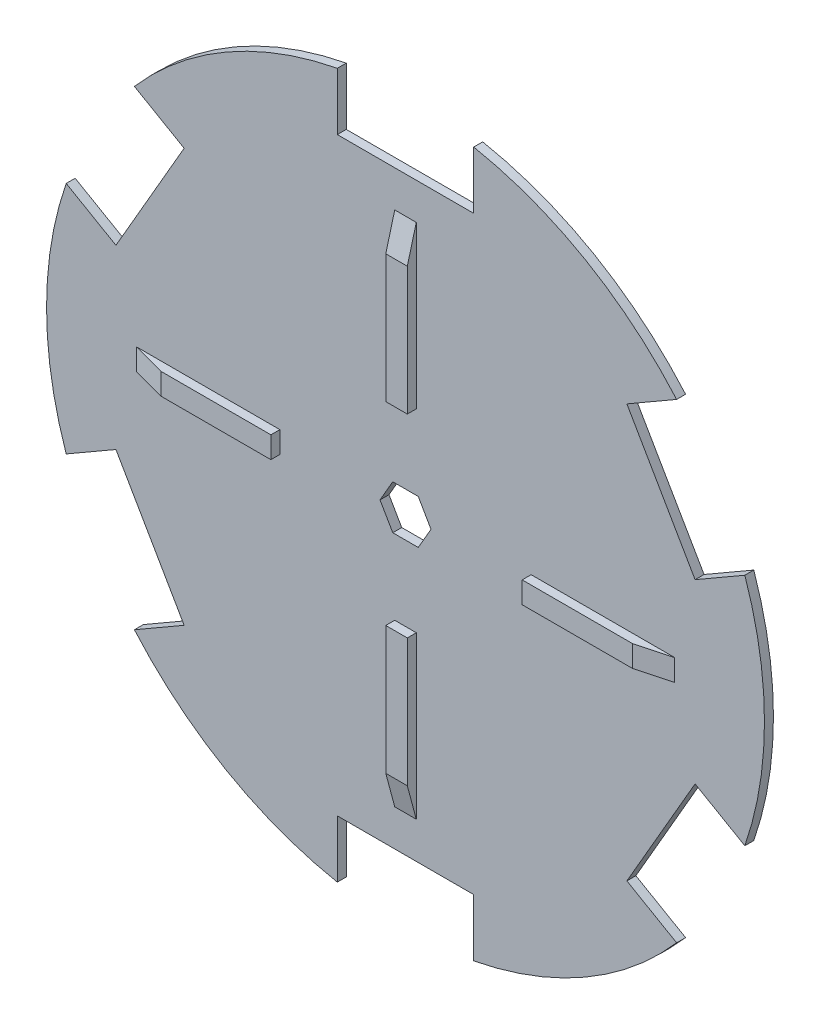
from build123d import *
from OCP.BRepFilletAPI import BRepFilletAPI_MakeChamfer

# Parameters (mm, degrees)
SKETCH1_R           = 100
BOSS_EXTRUDE1_DEPTH = 2.5
SKETCH8_W           = 1.221153846
SKETCH8_H           = 0.325641026
CUT_EXTRUDE6_DEPTH  = 0.2
CUT_EXTRUDE7_DEPTH  = 10
BOSS_EXTRUDE2_DEPTH = 2.5
CHAMFER1_SIZE       = 2.5
CHAMFER1_SIZE_2     = 9.330127019
CUT_EXTRUDE8_START  = -10
CUT_EXTRUDE8_DEPTH  = 10


with BuildPart() as part:
    # Sketch1 → Boss-Extrude1 (new body)
    with BuildSketch(Plane.XY):
        Circle(SKETCH1_R)
    extrude(amount=BOSS_EXTRUDE1_DEPTH)

    # Sketch8 → Cut-Extrude6 (cut)
    # profile 1 of 12: a face of its own
    with BuildSketch(Plane(origin=(0, 0, 0), x_dir=(-1, 0, 0), z_dir=(0, 0, -1))):
        with BuildLine():
            add(Edge.make_bspline(
                [(-21.303796635, -42.5044388), (-21.303499075, -42.453550456), (-21.302921062, -42.354699113), (-21.296490852, -42.210658759), (-21.285808934, -42.075530497), (-21.271170032, -41.949307858), (-21.253355578, -41.831958258), (-21.229574387, -41.723795299), (-21.202529916, -41.62431837), (-21.171185911, -41.533203084), (-21.135818417, -41.449221882), (-21.09732448, -41.370821878), (-21.054176417, -41.298121696), (-21.008840217, -41.229960986), (-20.959480695, -41.167455492), (-20.907502507, -41.109722505), (-20.850876948, -41.058096324), (-20.791528933, -41.011064321), (-20.72892114, -40.969835158), (-20.66483815, -40.933519745), (-20.598838876, -40.902495579), (-20.530743124, -40.878102113), (-20.461162947, -40.857953702), (-20.389855107, -40.844175156), (-20.31670187, -40.835505675), (-20.267324783, -40.834676848), (-20.242283213, -40.834256508)],
                knots=[0, 0, 0, 0, 1.646270934, 3.197905019, 4.663502075, 6.030701355, 7.308322542, 8.50163776, 9.611534131, 10.641858119, 11.616356847, 12.558055219, 13.465016945, 14.349605745, 15.204443733, 16.039544428, 16.859896111, 17.680448484, 18.487036065, 19.28249412, 20.06191084, 20.843045899, 21.620316918, 22.403196591, 23.190181807, 24, 24, 24, 24], degree=3))
            add(Edge.make_bspline(
                [(-20.242283213, -40.834256508), (-20.217032458, -40.834699027), (-20.16681665, -40.835579056), (-20.092575738, -40.844037204), (-20.020049955, -40.858071722), (-19.949548501, -40.877957178), (-19.880492263, -40.902627542), (-19.813421379, -40.933549427), (-19.747919241, -40.969543828), (-19.685026766, -41.011838345), (-19.624053507, -41.058993695), (-19.566497141, -41.112299831), (-19.512352427, -41.171218505), (-19.460939829, -41.235119338), (-19.413717966, -41.305227951), (-19.368747781, -41.380324965), (-19.328496005, -41.461723678), (-19.28972955, -41.548065959), (-19.256267783, -41.64174085), (-19.226090547, -41.742220311), (-19.201707482, -41.850691181), (-19.181397214, -41.966584346), (-19.165662915, -42.09032542), (-19.154203304, -42.221649149), (-19.148149863, -42.360641932), (-19.147009855, -42.455672267), (-19.14642484, -42.5044388)],
                knots=[0, 0, 0, 0, 0.810914788, 1.612654377, 2.396697861, 3.181598691, 3.963628158, 4.749916497, 5.551656086, 6.361998678, 7.18212741, 8.025565596, 8.878627764, 9.750805457, 10.657531673, 11.591944965, 12.560506719, 13.57287815, 14.630710178, 15.753379473, 16.941251878, 18.199788006, 19.531962791, 20.947069417, 22.433333509, 24, 24, 24, 24], degree=3))
            add(Edge.make_bspline(
                [(-19.14642484, -42.5044388), (-19.14701592, -42.552992631), (-19.148167616, -42.64759779), (-19.154135443, -42.785965175), (-19.165890773, -42.916591971), (-19.180595548, -43.039791462), (-19.200961778, -43.155050874), (-19.226003608, -43.262769052), (-19.253807829, -43.363411174), (-19.288129392, -43.456152753), (-19.325694822, -43.54228753), (-19.366566322, -43.622721301), (-19.41035395, -43.698165009), (-19.458059454, -43.768014779), (-19.508907908, -43.832765418), (-19.563987616, -43.891273976), (-19.621745933, -43.944950228), (-19.682898624, -43.992712776), (-19.74677196, -44.034518277), (-19.812049122, -44.071905127), (-19.879888334, -44.102051929), (-19.948752227, -44.127937288), (-20.019625817, -44.147713412), (-20.092420757, -44.161387553), (-20.166766771, -44.170977729), (-20.217023905, -44.171709322), (-20.242283213, -44.172077021)],
                knots=[0, 0, 0, 0, 1.561518951, 3.042555995, 4.452378317, 5.7783523, 7.031515105, 8.214008947, 9.334062868, 10.386615937, 11.391082383, 12.354592575, 13.286541444, 14.194233754, 15.072674879, 15.931287219, 16.775624067, 17.606195743, 18.42308326, 19.229000347, 20.022332153, 20.807536673, 21.593273796, 22.3848459, 23.188221202, 24, 24, 24, 24], degree=3))
            add(Edge.make_bspline(
                [(-20.242283213, -44.172077021), (-20.267324088, -44.17165397), (-20.316699806, -44.170819796), (-20.389863077, -44.162189483), (-20.460876437, -44.148314276), (-20.530090306, -44.128886357), (-20.597859788, -44.105105755), (-20.663261419, -44.074123485), (-20.72702239, -44.038441865), (-20.788972587, -43.997806019), (-20.847947904, -43.951249921), (-20.904280211, -43.899756602), (-20.956554335, -43.842041078), (-21.005208122, -43.779014677), (-21.051448902, -43.711257236), (-21.093984262, -43.63784364), (-21.133327822, -43.559064986), (-21.169290132, -43.47441231), (-21.201174991, -43.38265034), (-21.229339697, -43.282729299), (-21.25157754, -43.173767258), (-21.270612078, -43.056639361), (-21.285964912, -42.930842295), (-21.296446335, -42.796307768), (-21.302924528, -42.653119614), (-21.303500628, -42.554903462), (-21.303796635, -42.5044388)],
                knots=[0, 0, 0, 0, 0.810891512, 1.598919785, 2.382837074, 3.152667961, 3.926044502, 4.706494248, 5.493654104, 6.291793342, 7.103789334, 7.925228297, 8.761435821, 9.622817696, 10.50288917, 11.416980706, 12.369136599, 13.353924996, 14.394355917, 15.514179734, 16.714354668, 17.994756427, 19.357759367, 20.818452758, 22.365282078, 24, 24, 24, 24], degree=3))
        make_face()
        with BuildLine():
            add(Edge.make_bspline(
                [(-21.018860737, -42.503166765), (-21.018752382, -42.545574513), (-21.018542085, -42.627879625), (-21.013048246, -42.747480298), (-21.005564107, -42.859031953), (-20.99591093, -42.962676233), (-20.981575398, -43.058062315), (-20.965512812, -43.145846242), (-20.945965617, -43.22556345), (-20.922837993, -43.297760964), (-20.896495384, -43.363664048), (-20.867733636, -43.424988007), (-20.836835695, -43.482457264), (-20.802256179, -43.535555608), (-20.764596086, -43.5844562), (-20.724706058, -43.630024555), (-20.681097357, -43.670661817), (-20.620768962, -43.71939975), (-20.541125017, -43.769763535), (-20.440776462, -43.813620345), (-20.337662938, -43.841181574), (-20.267675733, -43.844686552), (-20.232742949, -43.846435996)],
                knots=[0, 0, 0, 0, 1.459021318, 2.831673884, 4.118529203, 5.306027144, 6.411944654, 7.436330062, 8.375795394, 9.233974572, 10.042671642, 10.816086306, 11.563610507, 12.285937304, 12.993564865, 13.685989202, 14.367179055, 15.041617293, 16.353048772, 17.594441528, 18.799311195, 20, 20, 20, 20], degree=3))
            add(Edge.make_bspline(
                [(-20.232742949, -43.846435996), (-20.197584204, -43.84498658), (-20.127339304, -43.842090742), (-20.024710789, -43.814151887), (-19.925079044, -43.771997376), (-19.846999499, -43.722152139), (-19.787597477, -43.674682869), (-19.745037065, -43.63421101), (-19.705973635, -43.588893901), (-19.668924038, -43.53999954), (-19.634943305, -43.486593787), (-19.604043173, -43.42893345), (-19.575846137, -43.36685841), (-19.559781502, -43.323524433), (-19.551568069, -43.301368888)],
                knots=[0, 0, 0, 0, 1.353760809, 2.704726607, 4.075137775, 5.516104923, 6.260822281, 7.007110065, 7.778089737, 8.566572457, 9.372053459, 10.217411131, 11.088608312, 12, 12, 12, 12], degree=3))
            add(Edge.make_bspline(
                [(-19.551568069, -43.301368888), (-19.541996108, -43.273039053), (-19.522560923, -43.215517338), (-19.497513099, -43.126287454), (-19.477786916, -43.032667804), (-19.460040148, -42.935217877), (-19.447927019, -42.833219005), (-19.438177217, -42.726986785), (-19.432434379, -42.616441121), (-19.431722498, -42.541334236), (-19.431360737, -42.503166765)],
                knots=[0, 0, 0, 0, 0.884706709, 1.796334032, 2.740027952, 3.714592787, 4.726048262, 5.777819803, 6.87074269, 8, 8, 8, 8], degree=3))
            add(Edge.make_bspline(
                [(-19.431360737, -42.503166765), (-19.431859838, -42.465005467), (-19.432836184, -42.39035381), (-19.436568159, -42.281026604), (-19.446205259, -42.177187992), (-19.456908745, -42.078390635), (-19.47269051, -41.985181431), (-19.48970652, -41.896780083), (-19.51256762, -41.814281768), (-19.536987702, -41.736394861), (-19.564937132, -41.664004268), (-19.595703548, -41.596772476), (-19.628561858, -41.534374904), (-19.66425089, -41.47698275), (-19.702346974, -41.424338943), (-19.743855608, -41.377498989), (-19.787130289, -41.335011168), (-19.847743022, -41.286512981), (-19.927094699, -41.237063086), (-20.025833251, -41.191555575), (-20.128585906, -41.165422338), (-20.198048968, -41.161737808), (-20.232742949, -41.159897534)],
                knots=[0, 0, 0, 0, 1.31362396, 2.569729283, 3.763502607, 4.902122613, 5.988968491, 7.01645872, 7.998833611, 8.933434873, 9.825090667, 10.667526885, 11.477055099, 12.250526234, 12.991942729, 13.710640831, 14.402115721, 15.076753259, 16.378508321, 17.609869233, 18.806226677, 20, 20, 20, 20], degree=3))
            add(Edge.make_bspline(
                [(-20.232742949, -41.159897534), (-20.267858986, -41.161740346), (-20.338155033, -41.165429328), (-20.441975678, -41.191458208), (-20.541493197, -41.236827113), (-20.620635038, -41.286676765), (-20.681290045, -41.334155091), (-20.724000774, -41.375327088), (-20.764047658, -41.420363333), (-20.800939072, -41.469713642), (-20.835491493, -41.522750082), (-20.867224269, -41.57988989), (-20.895814989, -41.641422628), (-20.922198819, -41.707296108), (-20.945396991, -41.779487394), (-20.964532229, -41.859106409), (-20.98220977, -41.946611125), (-20.994724049, -42.042513822), (-21.005849028, -42.146184061), (-21.012998536, -42.2580142), (-21.018560463, -42.377815459), (-21.018758641, -42.460546124), (-21.018860737, -42.503166765)],
                knots=[0, 0, 0, 0, 1.207732386, 2.417664972, 3.655092373, 4.956220595, 5.625982001, 6.301752483, 6.994047911, 7.697131622, 8.419323945, 9.170223765, 9.943494443, 10.752040957, 11.610060368, 12.549350801, 13.567764191, 14.679664412, 15.874934091, 17.154273443, 18.533957287, 20, 20, 20, 20], degree=3))
        make_face(mode=Mode.SUBTRACT)
    # profile 2 of 12: a face of its own
    with BuildSketch(Plane(origin=(0, 0, 0), x_dir=(-1, 0, 0), z_dir=(0, 0, -1))):
        with BuildLine():
            Line((-18.45443766, -41.892589842), (-18.739373558, -41.892589842))
            add(Edge.make_bspline(
                [(-18.739373558, -41.892589842), (-18.737516498, -41.854788394), (-18.733869281, -41.780547355), (-18.716789333, -41.672303526), (-18.692350108, -41.56883953), (-18.657795718, -41.470986108), (-18.614882166, -41.377878047), (-18.563419927, -41.289885176), (-18.502465505, -41.207343169), (-18.433335111, -41.131017218), (-18.358252131, -41.060997065), (-18.277238886, -41.000531237), (-18.19210804, -40.949443064), (-18.103117871, -40.906733652), (-18.00926436, -40.874675363), (-17.911399196, -40.85088859), (-17.809092408, -40.836577191), (-17.73938753, -40.835038871), (-17.703936859, -40.834256508)],
                knots=[0, 0, 0, 0, 1.10065271, 2.161652631, 3.183658789, 4.190468796, 5.17591951, 6.163126047, 7.15150782, 8.156236427, 9.156009102, 10.134482811, 11.092018607, 12.041330605, 13.001268258, 13.972401359, 14.968799086, 16, 16, 16, 16], degree=3))
            add(Edge.make_bspline(
                [(-17.703936859, -40.834256508), (-17.669122463, -40.835071537), (-17.600713419, -40.836673038), (-17.500871449, -40.850426258), (-17.405823475, -40.871966902), (-17.315755287, -40.902188744), (-17.231385499, -40.942814617), (-17.152080309, -40.99161667), (-17.076895574, -41.048058946), (-17.009216563, -41.114510619), (-16.947069948, -41.185451354), (-16.893455759, -41.261186809), (-16.84754239, -41.33940909), (-16.809272137, -41.420714673), (-16.781099783, -41.505869105), (-16.75971098, -41.593632639), (-16.747621111, -41.684913718), (-16.74576562, -41.746696093), (-16.744822276, -41.778106669)],
                knots=[0, 0, 0, 0, 1.111607364, 2.184268762, 3.212621178, 4.221274766, 5.211760367, 6.196651075, 7.1921475, 8.207485113, 9.220403448, 10.201281604, 11.166441695, 12.114753415, 13.065576456, 14.026450734, 14.996634279, 16, 16, 16, 16], degree=3))
            add(Edge.make_bspline(
                [(-16.744822276, -41.778106669), (-16.746358307, -41.822327919), (-16.749403415, -41.909994398), (-16.775451456, -42.038822167), (-16.816133648, -42.163639054), (-16.865116965, -42.264093606), (-16.914531253, -42.345041133), (-16.959060635, -42.411687744), (-17.011189428, -42.483447704), (-17.071676351, -42.560080718), (-17.139270171, -42.642187039), (-17.214583134, -42.729717067), (-17.298152292, -42.821766459), (-17.356806789, -42.88463654), (-17.38720008, -42.917214241)],
                knots=[0, 0, 0, 0, 1.184426356, 2.348067706, 3.509069118, 4.696110526, 5.333549288, 6.050745305, 6.844228056, 7.710549037, 8.667450064, 9.695053472, 10.805634456, 12, 12, 12, 12], degree=3))
            Line((-17.38720008, -42.917214241), (-18.181586098, -43.765025739))
            Line((-18.181586098, -43.765025739), (-16.704117148, -43.765025739))
            Line((-16.704117148, -43.765025739), (-16.704117148, -44.090666765))
            Line((-16.704117148, -44.090666765), (-18.861488943, -44.090666765))
            Line((-18.861488943, -44.090666765), (-17.630158814, -42.776654345))
            add(Edge.make_bspline(
                [(-17.630158814, -42.776654345), (-17.60017966, -42.745359453), (-17.54259584, -42.685248369), (-17.461150216, -42.597488684), (-17.387999134, -42.516073029), (-17.322669071, -42.441155231), (-17.266577248, -42.371639452), (-17.216800295, -42.309777114), (-17.176917223, -42.252849863), (-17.133632542, -42.186863734), (-17.091709859, -42.106298275), (-17.055685079, -42.007842714), (-17.033718752, -41.906490135), (-17.031083652, -41.837999001), (-17.029758173, -41.803547374)],
                knots=[0, 0, 0, 0, 1.329631726, 2.553950428, 3.673215718, 4.687767853, 5.603093632, 6.413772471, 7.123043292, 7.734684054, 8.834405432, 9.900288307, 10.943827018, 12, 12, 12, 12], degree=3))
            add(Edge.make_bspline(
                [(-17.029758173, -41.803547374), (-17.030334882, -41.781883534), (-17.031471465, -41.739188265), (-17.041502377, -41.676590184), (-17.056661193, -41.616206389), (-17.078382963, -41.557851141), (-17.107054791, -41.502111157), (-17.141955643, -41.448918586), (-17.182223772, -41.397493596), (-17.228806709, -41.349275961), (-17.279980016, -41.305115153), (-17.334040514, -41.265995447), (-17.391235966, -41.233302825), (-17.451325219, -41.206502653), (-17.514140752, -41.185479271), (-17.579804057, -41.170911846), (-17.6481337, -41.161765592), (-17.694791229, -41.160528093), (-17.718565265, -41.159897534)],
                knots=[0, 0, 0, 0, 0.991446411, 1.95395049, 2.89581595, 3.838931463, 4.798493298, 5.75982156, 6.748411868, 7.785213223, 8.824556874, 9.840280684, 10.836137867, 11.835679398, 12.848801643, 13.863922112, 14.911575587, 16, 16, 16, 16], degree=3))
            add(Edge.make_bspline(
                [(-17.718565265, -41.159897534), (-17.74339452, -41.160546171), (-17.792155078, -41.161819985), (-17.863745915, -41.170730545), (-17.93204087, -41.186102843), (-17.997211739, -41.207127398), (-18.059368792, -41.23385051), (-18.118209747, -41.267135164), (-18.17360251, -41.306853047), (-18.225651214, -41.351884123), (-18.273606395, -41.402019733), (-18.315740346, -41.457908771), (-18.352555845, -41.518530783), (-18.384677078, -41.583722197), (-18.410762597, -41.654074554), (-18.430695384, -41.729338115), (-18.446467737, -41.809186083), (-18.451736895, -41.864326838), (-18.45443766, -41.892589842)],
                knots=[0, 0, 0, 0, 1.031018746, 2.02475058, 2.990194455, 3.934040569, 4.864654155, 5.795059489, 6.735614925, 7.690564532, 8.649604399, 9.611025574, 10.590972636, 11.591080095, 12.624614302, 13.701020113, 14.821632451, 16, 16, 16, 16], degree=3))
        make_face()
    # profile 3 of 12: a face of its own
    with BuildSketch(Plane(origin=(0, 0, 0), x_dir=(-1, 0, 0), z_dir=(0, 0, -1))):
        with Locations((-15.808604327, -42.869512919)):
            Rectangle(SKETCH8_W, SKETCH8_H)
    # profile 4 of 12: a face of its own
    with BuildSketch(Plane(origin=(0, 0, 0), x_dir=(-1, 0, 0), z_dir=(0, 0, -1))):
        with BuildLine():
            add(Edge.make_bspline(
                [(-14.953796635, -42.5044388), (-14.953499075, -42.453550456), (-14.952921062, -42.354699113), (-14.946490852, -42.210658759), (-14.935808934, -42.075530497), (-14.921170032, -41.949307858), (-14.903355578, -41.831958258), (-14.879574387, -41.723795299), (-14.852529916, -41.62431837), (-14.821185911, -41.533203084), (-14.785818417, -41.449221882), (-14.74732448, -41.370821878), (-14.704176417, -41.298121696), (-14.658840217, -41.229960986), (-14.609480695, -41.167455492), (-14.557502507, -41.109722505), (-14.500876948, -41.058096324), (-14.441528933, -41.011064321), (-14.37892114, -40.969835158), (-14.31483815, -40.933519745), (-14.248838876, -40.902495579), (-14.180743124, -40.878102113), (-14.111162947, -40.857953702), (-14.039855107, -40.844175156), (-13.96670187, -40.835505675), (-13.917324783, -40.834676848), (-13.892283213, -40.834256508)],
                knots=[0, 0, 0, 0, 1.646270934, 3.197905019, 4.663502075, 6.030701355, 7.308322542, 8.50163776, 9.611534131, 10.641858119, 11.616356847, 12.558055219, 13.465016945, 14.349605745, 15.204443733, 16.039544428, 16.859896111, 17.680448484, 18.487036065, 19.28249412, 20.06191084, 20.843045899, 21.620316918, 22.403196591, 23.190181807, 24, 24, 24, 24], degree=3))
            add(Edge.make_bspline(
                [(-13.892283213, -40.834256508), (-13.867032458, -40.834699027), (-13.81681665, -40.835579056), (-13.742575738, -40.844037204), (-13.670049955, -40.858071722), (-13.599548501, -40.877957178), (-13.530492263, -40.902627542), (-13.463421379, -40.933549427), (-13.397919241, -40.969543828), (-13.335026766, -41.011838345), (-13.274053507, -41.058993695), (-13.216497141, -41.112299831), (-13.162352427, -41.171218505), (-13.110939829, -41.235119338), (-13.063717966, -41.305227951), (-13.018747781, -41.380324965), (-12.978496005, -41.461723678), (-12.93972955, -41.548065959), (-12.906267783, -41.64174085), (-12.876090547, -41.742220311), (-12.851707482, -41.850691181), (-12.831397214, -41.966584346), (-12.815662915, -42.09032542), (-12.804203304, -42.221649149), (-12.798149863, -42.360641932), (-12.797009855, -42.455672267), (-12.79642484, -42.5044388)],
                knots=[0, 0, 0, 0, 0.810914788, 1.612654377, 2.396697861, 3.181598691, 3.963628158, 4.749916497, 5.551656086, 6.361998678, 7.18212741, 8.025565596, 8.878627764, 9.750805457, 10.657531673, 11.591944965, 12.560506719, 13.57287815, 14.630710178, 15.753379473, 16.941251878, 18.199788006, 19.531962791, 20.947069417, 22.433333509, 24, 24, 24, 24], degree=3))
            add(Edge.make_bspline(
                [(-12.79642484, -42.5044388), (-12.79701592, -42.552992631), (-12.798167616, -42.64759779), (-12.804135443, -42.785965175), (-12.815890773, -42.916591971), (-12.830595548, -43.039791462), (-12.850961778, -43.155050874), (-12.876003608, -43.262769052), (-12.903807829, -43.363411174), (-12.938129392, -43.456152753), (-12.975694822, -43.54228753), (-13.016566322, -43.622721301), (-13.06035395, -43.698165009), (-13.108059454, -43.768014779), (-13.158907908, -43.832765418), (-13.213987616, -43.891273976), (-13.271745933, -43.944950228), (-13.332898624, -43.992712776), (-13.39677196, -44.034518277), (-13.462049122, -44.071905127), (-13.529888334, -44.102051929), (-13.598752227, -44.127937288), (-13.669625817, -44.147713412), (-13.742420757, -44.161387553), (-13.816766771, -44.170977729), (-13.867023905, -44.171709322), (-13.892283213, -44.172077021)],
                knots=[0, 0, 0, 0, 1.561518951, 3.042555995, 4.452378317, 5.7783523, 7.031515105, 8.214008947, 9.334062868, 10.386615937, 11.391082383, 12.354592575, 13.286541444, 14.194233754, 15.072674879, 15.931287219, 16.775624067, 17.606195743, 18.42308326, 19.229000347, 20.022332153, 20.807536673, 21.593273796, 22.3848459, 23.188221202, 24, 24, 24, 24], degree=3))
            add(Edge.make_bspline(
                [(-13.892283213, -44.172077021), (-13.917324088, -44.17165397), (-13.966699806, -44.170819796), (-14.039863077, -44.162189483), (-14.110876437, -44.148314276), (-14.180090306, -44.128886357), (-14.247859788, -44.105105755), (-14.313261419, -44.074123485), (-14.37702239, -44.038441865), (-14.438972587, -43.997806019), (-14.497947904, -43.951249921), (-14.554280211, -43.899756602), (-14.606554335, -43.842041078), (-14.655208122, -43.779014677), (-14.701448902, -43.711257236), (-14.743984262, -43.63784364), (-14.783327822, -43.559064986), (-14.819290132, -43.47441231), (-14.851174991, -43.38265034), (-14.879339697, -43.282729299), (-14.90157754, -43.173767258), (-14.920612078, -43.056639361), (-14.935964912, -42.930842295), (-14.946446335, -42.796307768), (-14.952924528, -42.653119614), (-14.953500628, -42.554903462), (-14.953796635, -42.5044388)],
                knots=[0, 0, 0, 0, 0.810891512, 1.598919785, 2.382837074, 3.152667961, 3.926044502, 4.706494248, 5.493654104, 6.291793342, 7.103789334, 7.925228297, 8.761435821, 9.622817696, 10.50288917, 11.416980706, 12.369136599, 13.353924996, 14.394355917, 15.514179734, 16.714354668, 17.994756427, 19.357759367, 20.818452758, 22.365282078, 24, 24, 24, 24], degree=3))
        make_face()
        with BuildLine():
            add(Edge.make_bspline(
                [(-14.668860737, -42.503166765), (-14.668752382, -42.545574513), (-14.668542085, -42.627879625), (-14.663048246, -42.747480298), (-14.655564107, -42.859031953), (-14.64591093, -42.962676233), (-14.631575398, -43.058062315), (-14.615512812, -43.145846242), (-14.595965617, -43.22556345), (-14.572837993, -43.297760964), (-14.546495384, -43.363664048), (-14.517733636, -43.424988007), (-14.486835695, -43.482457264), (-14.452256179, -43.535555608), (-14.414596086, -43.5844562), (-14.374706058, -43.630024555), (-14.331097357, -43.670661817), (-14.270768962, -43.71939975), (-14.191125017, -43.769763535), (-14.090776462, -43.813620345), (-13.987662938, -43.841181574), (-13.917675733, -43.844686552), (-13.882742949, -43.846435996)],
                knots=[0, 0, 0, 0, 1.459021318, 2.831673884, 4.118529203, 5.306027144, 6.411944654, 7.436330062, 8.375795394, 9.233974572, 10.042671642, 10.816086306, 11.563610507, 12.285937304, 12.993564865, 13.685989202, 14.367179055, 15.041617293, 16.353048772, 17.594441528, 18.799311195, 20, 20, 20, 20], degree=3))
            add(Edge.make_bspline(
                [(-13.882742949, -43.846435996), (-13.847584204, -43.84498658), (-13.777339304, -43.842090742), (-13.674710789, -43.814151887), (-13.575079044, -43.771997376), (-13.496999499, -43.722152139), (-13.437597477, -43.674682869), (-13.395037065, -43.63421101), (-13.355973635, -43.588893901), (-13.318924038, -43.53999954), (-13.284943305, -43.486593787), (-13.254043173, -43.42893345), (-13.225846137, -43.36685841), (-13.209781502, -43.323524433), (-13.201568069, -43.301368888)],
                knots=[0, 0, 0, 0, 1.353760809, 2.704726607, 4.075137775, 5.516104923, 6.260822281, 7.007110065, 7.778089737, 8.566572457, 9.372053459, 10.217411131, 11.088608312, 12, 12, 12, 12], degree=3))
            add(Edge.make_bspline(
                [(-13.201568069, -43.301368888), (-13.191996108, -43.273039053), (-13.172560923, -43.215517338), (-13.147513099, -43.126287454), (-13.127786916, -43.032667804), (-13.110040148, -42.935217877), (-13.097927019, -42.833219005), (-13.088177217, -42.726986785), (-13.082434379, -42.616441121), (-13.081722498, -42.541334236), (-13.081360737, -42.503166765)],
                knots=[0, 0, 0, 0, 0.884706709, 1.796334032, 2.740027952, 3.714592787, 4.726048262, 5.777819803, 6.87074269, 8, 8, 8, 8], degree=3))
            add(Edge.make_bspline(
                [(-13.081360737, -42.503166765), (-13.081859838, -42.465005467), (-13.082836184, -42.39035381), (-13.086568159, -42.281026604), (-13.096205259, -42.177187992), (-13.106908745, -42.078390635), (-13.12269051, -41.985181431), (-13.13970652, -41.896780083), (-13.16256762, -41.814281768), (-13.186987702, -41.736394861), (-13.214937132, -41.664004268), (-13.245703548, -41.596772476), (-13.278561858, -41.534374904), (-13.31425089, -41.47698275), (-13.352346974, -41.424338943), (-13.393855608, -41.377498989), (-13.437130289, -41.335011168), (-13.497743022, -41.286512981), (-13.577094699, -41.237063086), (-13.675833251, -41.191555575), (-13.778585906, -41.165422338), (-13.848048968, -41.161737808), (-13.882742949, -41.159897534)],
                knots=[0, 0, 0, 0, 1.31362396, 2.569729283, 3.763502607, 4.902122613, 5.988968491, 7.01645872, 7.998833611, 8.933434873, 9.825090667, 10.667526885, 11.477055099, 12.250526234, 12.991942729, 13.710640831, 14.402115721, 15.076753259, 16.378508321, 17.609869233, 18.806226677, 20, 20, 20, 20], degree=3))
            add(Edge.make_bspline(
                [(-13.882742949, -41.159897534), (-13.917858986, -41.161740346), (-13.988155033, -41.165429328), (-14.091975678, -41.191458208), (-14.191493197, -41.236827113), (-14.270635038, -41.286676765), (-14.331290045, -41.334155091), (-14.374000774, -41.375327088), (-14.414047658, -41.420363333), (-14.450939072, -41.469713642), (-14.485491493, -41.522750082), (-14.517224269, -41.57988989), (-14.545814989, -41.641422628), (-14.572198819, -41.707296108), (-14.595396991, -41.779487394), (-14.614532229, -41.859106409), (-14.63220977, -41.946611125), (-14.644724049, -42.042513822), (-14.655849028, -42.146184061), (-14.662998536, -42.2580142), (-14.668560463, -42.377815459), (-14.668758641, -42.460546124), (-14.668860737, -42.503166765)],
                knots=[0, 0, 0, 0, 1.207732386, 2.417664972, 3.655092373, 4.956220595, 5.625982001, 6.301752483, 6.994047911, 7.697131622, 8.419323945, 9.170223765, 9.943494443, 10.752040957, 11.610060368, 12.549350801, 13.567764191, 14.679664412, 15.874934091, 17.154273443, 18.533957287, 20, 20, 20, 20], degree=3))
        make_face(mode=Mode.SUBTRACT)
    # profile 5 of 12: a face of its own
    with BuildSketch(Plane(origin=(0, 0, 0), x_dir=(-1, 0, 0), z_dir=(0, 0, -1))):
        Polygon((-10.778340906, -40.834256508), (-10.720463301, -40.834256508), (-10.720463301, -43.032333432), (-10.354117148, -43.032333432), (-10.354117148, -43.357974457), (-10.720463301, -43.357974457), (-10.720463301, -44.090666765), (-11.005399199, -44.090666765), (-11.005399199, -43.357974457), (-12.511488943, -43.357974457), align=None)
        Polygon((-11.005399199, -43.032333432), (-11.005399199, -41.653447214), (-11.95179343, -43.032333432), align=None, mode=Mode.SUBTRACT)
    # profile 6 of 12: a face of its own
    with BuildSketch(Plane(origin=(0, 0, 0), x_dir=(-1, 0, 0), z_dir=(0, 0, -1))):
        with Locations((-9.458604327, -42.869512919)):
            Rectangle(SKETCH8_W, SKETCH8_H)
    # profile 7 of 12: a face of its own
    with BuildSketch(Plane(origin=(0, 0, 0), x_dir=(-1, 0, 0), z_dir=(0, 0, -1))):
        Polygon((-7.928981931, -40.915666765), (-7.34193766, -40.915666765), (-7.34193766, -44.090666765), (-7.626873558, -44.090666765), (-7.626873558, -41.241307791), (-8.115335096, -41.241307791), align=None)
    # profile 8 of 12: a face of its own
    with BuildSketch(Plane(origin=(0, 0, 0), x_dir=(-1, 0, 0), z_dir=(0, 0, -1))):
        Polygon((-4.428340906, -40.834256508), (-4.370463301, -40.834256508), (-4.370463301, -43.032333432), (-4.004117148, -43.032333432), (-4.004117148, -43.357974457), (-4.370463301, -43.357974457), (-4.370463301, -44.090666765), (-4.655399199, -44.090666765), (-4.655399199, -43.357974457), (-6.161488943, -43.357974457), align=None)
        Polygon((-4.655399199, -43.032333432), (-4.655399199, -41.653447214), (-5.60179343, -43.032333432), align=None, mode=Mode.SUBTRACT)
    # profile 9 of 12: a face of its own
    with BuildSketch(Plane(origin=(0, 0, 0), x_dir=(-1, 0, 0), z_dir=(0, 0, -1))):
        Polygon((-3.044366547, -40.915666765), (-2.457322276, -40.915666765), (-2.457322276, -44.090666765), (-2.742258173, -44.090666765), (-2.742258173, -41.241307791), (-3.230719712, -41.241307791), align=None)
    # profile 10 of 12: a face of its own
    with BuildSketch(Plane(origin=(0, 0, 0), x_dir=(-1, 0, 0), z_dir=(0, 0, -1))):
        Polygon((-0.602058854, -40.915666765), (-0.015014584, -40.915666765), (-0.015014584, -44.090666765), (-0.299950481, -44.090666765), (-0.299950481, -41.241307791), (-0.788412019, -41.241307791), align=None)
    # profile 11 of 12: a face of its own
    with BuildSketch(Plane(origin=(0, 0, 0), x_dir=(-1, 0, 0), z_dir=(0, 0, -1))):
        Polygon((1.840248838, -40.915666765), (2.427293109, -40.915666765), (2.427293109, -44.090666765), (2.142357211, -44.090666765), (2.142357211, -41.241307791), (1.653895673, -41.241307791), align=None)
    # profile 12 of 12: a face of its own
    with BuildSketch(Plane(origin=(0, 0, 0), x_dir=(-1, 0, 0), z_dir=(0, 0, -1))):
        with BuildLine():
            add(Edge.make_bspline(
                [(5.15135661, -42.321901741), (5.177344935, -42.335452601), (5.228030848, -42.361881304), (5.300218744, -42.404436126), (5.36619071, -42.449286144), (5.427777148, -42.494312959), (5.483896045, -42.541240957), (5.533919905, -42.590256749), (5.579084389, -42.640136857), (5.618478685, -42.691725926), (5.653128673, -42.7448869), (5.683075396, -42.799759312), (5.70867243, -42.856222908), (5.72895881, -42.914894032), (5.745670007, -42.974910841), (5.757168591, -43.037048296), (5.763352509, -43.100896948), (5.764521647, -43.144048193), (5.765113622, -43.165897133)],
                knots=[0, 0, 0, 0, 1.272397273, 2.481599622, 3.635517121, 4.734568067, 5.792894095, 6.808321871, 7.773003508, 8.711915296, 9.623354172, 10.525449501, 11.423591555, 12.311487226, 13.218079475, 14.126165749, 15.051214107, 16, 16, 16, 16], degree=3))
            add(Edge.make_bspline(
                [(5.765113622, -43.165897133), (5.764413833, -43.196465791), (5.763028689, -43.256972634), (5.750963703, -43.346277321), (5.732899787, -43.433010866), (5.706520515, -43.517154254), (5.672309082, -43.598243185), (5.630147952, -43.676347073), (5.582422073, -43.752746017), (5.544093256, -43.799753618), (5.524698958, -43.823539361)],
                knots=[0, 0, 0, 0, 1.025265484, 2.029385089, 3.018602448, 3.995076438, 4.983346944, 5.966715145, 6.97116228, 8, 8, 8, 8], degree=3))
            add(Edge.make_bspline(
                [(5.524698958, -43.823539361), (5.499447299, -43.851292285), (5.449256023, -43.906455182), (5.363274368, -43.978074845), (5.268911659, -44.038263224), (5.166533028, -44.087314157), (5.056412144, -44.125492043), (4.938572468, -44.152926327), (4.812784272, -44.168640245), (4.726328595, -44.170911722), (4.681975601, -44.172077021)],
                knots=[0, 0, 0, 0, 0.954267603, 1.896743057, 2.838368354, 3.796610408, 4.779680527, 5.799409237, 6.871065594, 8, 8, 8, 8], degree=3))
            add(Edge.make_bspline(
                [(4.681975601, -44.172077021), (4.639327741, -44.171031559), (4.556339338, -44.168997196), (4.435546121, -44.155213676), (4.322948764, -44.131058397), (4.217892579, -44.09799793), (4.121010907, -44.05499008), (4.032579808, -44.001461023), (3.951323419, -43.939565358), (3.879707689, -43.867525444), (3.816127458, -43.790365803), (3.760276439, -43.710762557), (3.713854239, -43.62870844), (3.674550374, -43.545426949), (3.644462239, -43.459750795), (3.623623162, -43.372120783), (3.61038857, -43.282689975), (3.608627684, -43.222336261), (3.607741827, -43.191973856)],
                knots=[0, 0, 0, 0, 1.256902934, 2.445805442, 3.576955095, 4.645999104, 5.686449165, 6.692658513, 7.68621702, 8.689161843, 9.678783111, 10.630372946, 11.551080876, 12.453998257, 13.34127905, 14.221779781, 15.105423033, 16, 16, 16, 16], degree=3))
            add(Edge.make_bspline(
                [(3.607741827, -43.191973856), (3.608266047, -43.169695161), (3.609302092, -43.125664595), (3.616472919, -43.06061399), (3.628001309, -42.997298924), (3.643658102, -42.935485536), (3.664877104, -42.875623838), (3.690496754, -42.817430194), (3.720370739, -42.760838905), (3.754915796, -42.705540491), (3.795104061, -42.652309791), (3.840609657, -42.600243424), (3.892342081, -42.550149302), (3.949725814, -42.501415388), (4.012105075, -42.453177183), (4.081100121, -42.408041629), (4.154881921, -42.362813333), (4.207319682, -42.335772923), (4.234219191, -42.321901741)],
                knots=[0, 0, 0, 0, 0.941657376, 1.861047343, 2.762797495, 3.66048619, 4.553285746, 5.444104102, 6.34607688, 7.256116206, 8.197091036, 9.162375105, 10.176350973, 11.237807142, 12.343728897, 13.50695164, 14.721116704, 16, 16, 16, 16], degree=3))
            add(Edge.make_bspline(
                [(4.234219191, -42.321901741), (4.197397015, -42.301822344), (4.126098976, -42.26294301), (4.031693126, -42.191508408), (3.950603061, -42.114140176), (3.88505771, -42.029204576), (3.833466474, -41.939354912), (3.798071026, -41.84515334), (3.774125644, -41.74834658), (3.771753622, -41.682210244), (3.77056234, -41.64899509)],
                knots=[0, 0, 0, 0, 1.166880483, 2.259407225, 3.286803203, 4.280235371, 5.237608625, 6.161067461, 7.076446754, 8, 8, 8, 8], degree=3))
            add(Edge.make_bspline(
                [(3.77056234, -41.64899509), (3.772045903, -41.615160877), (3.775028124, -41.547148206), (3.799142993, -41.445905509), (3.838440482, -41.346467625), (3.891890244, -41.249316514), (3.958462933, -41.157740248), (4.038333728, -41.075606675), (4.12959529, -41.00365983), (4.231792069, -40.943265731), (4.341770654, -40.894113412), (4.45780849, -40.860205842), (4.577883809, -40.838038794), (4.659615311, -40.835529043), (4.70105613, -40.834256508)],
                knots=[0, 0, 0, 0, 0.888701115, 1.786444228, 2.72001202, 3.692817113, 4.693886446, 5.687152267, 6.695133018, 7.739871481, 8.800368666, 9.853104506, 10.91144658, 12, 12, 12, 12], degree=3))
            add(Edge.make_bspline(
                [(4.70105613, -40.834256508), (4.741427447, -40.835568548), (4.821035087, -40.838155741), (4.938051642, -40.859733838), (5.050015638, -40.895774188), (5.156540969, -40.944666669), (5.255720592, -41.004889108), (5.343352687, -41.077824187), (5.420761529, -41.159595451), (5.484791658, -41.251143948), (5.537553708, -41.347921752), (5.574293811, -41.449179325), (5.597835959, -41.552728828), (5.600805368, -41.622794732), (5.602293109, -41.657899337)],
                knots=[0, 0, 0, 0, 1.072916533, 2.115669174, 3.151510826, 4.193348718, 5.225979165, 6.227137561, 7.216255879, 8.211077061, 9.189680878, 10.138522389, 11.067357538, 12, 12, 12, 12], degree=3))
            add(Edge.make_bspline(
                [(5.602293109, -41.657899337), (5.600991757, -41.692349596), (5.598435977, -41.760007948), (5.576936746, -41.858638434), (5.540729669, -41.951005569), (5.491295678, -42.038157462), (5.426865415, -42.118513535), (5.348298921, -42.193095618), (5.25622258, -42.262516384), (5.187043062, -42.301692586), (5.15135661, -42.321901741)],
                knots=[0, 0, 0, 0, 0.975232327, 1.915300861, 2.843280834, 3.77672583, 4.742871857, 5.749627742, 6.839139064, 8, 8, 8, 8], degree=3))
        make_face()
        with BuildLine():
            add(Edge.make_bspline(
                [(4.685155689, -41.159897534), (4.662884601, -41.160488484), (4.619312614, -41.16164464), (4.555423748, -41.167684975), (4.494670244, -41.179435393), (4.436417339, -41.195073367), (4.381463702, -41.216198899), (4.329062999, -41.241050086), (4.280107048, -41.271263445), (4.234004866, -41.305155389), (4.192502378, -41.342432525), (4.155668249, -41.381270685), (4.125072031, -41.422432647), (4.099090453, -41.464894516), (4.080238648, -41.509916539), (4.066119601, -41.556118392), (4.056575196, -41.604083919), (4.055860013, -41.636864897), (4.055498237, -41.653447214)],
                knots=[0, 0, 0, 0, 1.203892937, 2.355340988, 3.463153438, 4.544400666, 5.610487187, 6.640501085, 7.674077295, 8.714426146, 9.728707835, 10.68524104, 11.601827946, 12.495867327, 13.368432065, 14.231010473, 15.105153427, 16, 16, 16, 16], degree=3))
            add(Edge.make_bspline(
                [(4.055498237, -41.653447214), (4.056121777, -41.670030247), (4.057353982, -41.702800704), (4.066883633, -41.751193025), (4.081086637, -41.798746939), (4.103448309, -41.844331694), (4.13026922, -41.889528598), (4.163372201, -41.933208058), (4.202822962, -41.975522086), (4.247297855, -42.016110779), (4.29574975, -42.054118943), (4.34707956, -42.087114614), (4.400643073, -42.1147227), (4.45588995, -42.137700089), (4.513383256, -42.155561675), (4.572770699, -42.168233233), (4.634062262, -42.176109044), (4.675591789, -42.177049771), (4.696604006, -42.177525739)],
                knots=[0, 0, 0, 0, 0.873023192, 1.725219244, 2.590779336, 3.480155217, 4.391973325, 5.357036234, 6.360879153, 7.436073238, 8.526419356, 9.601555421, 10.645666583, 11.697338044, 12.750135903, 13.812665442, 14.89329948, 16, 16, 16, 16], degree=3))
            add(Edge.make_bspline(
                [(4.696604006, -42.177525739), (4.7235916, -42.176733924), (4.777300234, -42.175158114), (4.856475056, -42.160506692), (4.933457598, -42.137459896), (5.007425033, -42.105927641), (5.076462763, -42.066350939), (5.138003397, -42.01896813), (5.191522007, -41.964873299), (5.236462417, -41.904908584), (5.271305635, -41.841089643), (5.298430847, -41.777045091), (5.314270663, -41.712091639), (5.316336742, -41.66857875), (5.317357211, -41.647087037)],
                knots=[0, 0, 0, 0, 1.076279235, 2.141928126, 3.20205304, 4.278698113, 5.344010996, 6.36967002, 7.368914609, 8.37248503, 9.349703398, 10.264243087, 11.142681841, 12, 12, 12, 12], degree=3))
            add(Edge.make_bspline(
                [(5.317357211, -41.647087037), (5.316874704, -41.632003033), (5.315916997, -41.602063447), (5.308024803, -41.557850787), (5.294983869, -41.514643951), (5.277328075, -41.472086005), (5.254096333, -41.430774056), (5.226551677, -41.390058683), (5.193092165, -41.350855811), (5.155539686, -41.31225185), (5.112953494, -41.276524914), (5.065415659, -41.245106284), (5.0131699, -41.218425075), (4.956214981, -41.196754561), (4.894760657, -41.180478287), (4.829089978, -41.1682896), (4.758655372, -41.161419706), (4.710186955, -41.160415929), (4.685155689, -41.159897534)],
                knots=[0, 0, 0, 0, 0.814439003, 1.616544685, 2.417341072, 3.248991801, 4.09997495, 4.973547432, 5.9003056, 6.880240646, 7.880314356, 8.896779544, 9.951930927, 11.043077905, 12.18215768, 13.381699519, 14.647792085, 16, 16, 16, 16], degree=3))
        make_face(mode=Mode.SUBTRACT)
        with BuildLine():
            add(Edge.make_bspline(
                [(4.7036002, -42.503166765), (4.675364666, -42.503668997), (4.619973438, -42.504654253), (4.538823224, -42.515621157), (4.460942139, -42.530887821), (4.386592768, -42.554047938), (4.315806508, -42.584161897), (4.248200161, -42.62038823), (4.184290922, -42.663210311), (4.124961306, -42.712084098), (4.070783714, -42.764752317), (4.02325097, -42.820507253), (3.982885363, -42.878312694), (3.950379485, -42.938902788), (3.923698842, -43.000994549), (3.906178397, -43.066134296), (3.894946415, -43.133069749), (3.893438171, -43.178572124), (3.892677724, -43.201514121)],
                knots=[0, 0, 0, 0, 1.140299081, 2.23698856, 3.303958914, 4.344563908, 5.37730929, 6.408454204, 7.439741482, 8.480804886, 9.510774543, 10.48932336, 11.43758569, 12.353841022, 13.263987381, 14.161954604, 15.073269652, 16, 16, 16, 16], degree=3))
            add(Edge.make_bspline(
                [(3.892677724, -43.201514121), (3.893914395, -43.230026443), (3.89636792, -43.286594223), (3.915832157, -43.370199295), (3.947070107, -43.451135538), (3.990635838, -43.528743381), (4.044581422, -43.601269548), (4.110917575, -43.664487223), (4.185521764, -43.72065885), (4.270918245, -43.766089049), (4.364198354, -43.802370096), (4.465337279, -43.82736729), (4.572883527, -43.843914891), (4.647141871, -43.845582384), (4.685155689, -43.846435996)],
                knots=[0, 0, 0, 0, 0.898778495, 1.783155532, 2.693654817, 3.627872908, 4.583023416, 5.533784346, 6.509005473, 7.520592997, 8.575161974, 9.658835044, 10.801527049, 12, 12, 12, 12], degree=3))
            add(Edge.make_bspline(
                [(4.685155689, -43.846435996), (4.714864951, -43.845865577), (4.772748121, -43.844754217), (4.857190375, -43.834944108), (4.93687793, -43.819386948), (5.011656254, -43.796759589), (5.082362452, -43.76913711), (5.147797708, -43.733602436), (5.209645372, -43.693187114), (5.264857827, -43.645237215), (5.315143666, -43.594002245), (5.358988867, -43.539764134), (5.39705036, -43.483996954), (5.426923441, -43.425440443), (5.450805114, -43.365218027), (5.467971482, -43.302774385), (5.478563477, -43.237917995), (5.479634718, -43.193922409), (5.480177724, -43.171621292)],
                knots=[0, 0, 0, 0, 1.224942928, 2.386581632, 3.501229538, 4.569074225, 5.605009692, 6.626002462, 7.634866581, 8.645888296, 9.63523824, 10.59253846, 11.518950513, 12.414518923, 13.29783783, 14.186679152, 15.080837789, 16, 16, 16, 16], degree=3))
            add(Edge.make_bspline(
                [(5.480177724, -43.171621292), (5.47935599, -43.149961133), (5.477735674, -43.107251083), (5.467451676, -43.043962877), (5.44938513, -42.982818896), (5.424595277, -42.923083533), (5.391592547, -42.865967142), (5.352726129, -42.809981758), (5.305832178, -42.756681269), (5.252843609, -42.705651675), (5.195095837, -42.658465971), (5.13371207, -42.616724301), (5.069164808, -42.581570596), (5.001590638, -42.552980632), (4.931139606, -42.530494856), (4.857863528, -42.514786775), (4.781676614, -42.504899278), (4.729919695, -42.503750794), (4.7036002, -42.503166765)],
                knots=[0, 0, 0, 0, 0.917430815, 1.809013306, 2.70690318, 3.612392954, 4.541220862, 5.495268465, 6.494511384, 7.542276156, 8.608045339, 9.649016899, 10.681629292, 11.715607085, 12.752076957, 13.808767841, 14.885711793, 16, 16, 16, 16], degree=3))
        make_face(mode=Mode.SUBTRACT)
    extrude(amount=-CUT_EXTRUDE6_DEPTH, mode=Mode.SUBTRACT)

    # Sketch9 → Cut-Extrude7 (cut)
    with BuildSketch(Plane.XY.offset(2.5)):
        Polygon((-7.101408311, 0), (-3.550704156, -6.15), (3.550704156, -6.15), (7.101408311, 0), (3.550704156, 6.15), (-3.550704156, 6.15), align=None)
    extrude(amount=-CUT_EXTRUDE7_DEPTH, mode=Mode.SUBTRACT)

    # Sketch11 → Boss-Extrude2 (add)
    with BuildSketch(Plane.XY.offset(2.5)):
        Polygon((-75, 0), (-75, 3), (-35, 3), (-35, -3), (-75, -3), align=None)
        Polygon((0, 72), (-3, 72), (-3, 27), (3, 27), (3, 72), align=None)
        Polygon((35, 3), (75, 3), (75, 0), (75, -3), (35, -3), align=None)
        Polygon((3, -27), (-3, -27), (-3, -72), (0, -72), (3, -72), align=None)
    extrude(amount=BOSS_EXTRUDE2_DEPTH)

    # Chamfer1
    chamfer1_edges_1 = [part.edges().sort_by_distance(p)[0] for p in [
        (75, 0, 5),
    ]]
    chamfer1_side_1 = [part.faces().sort_by_distance(p)[0] for p in [
        (75, 0, 4.95),
    ]]
    chamfer1_edges_2 = [part.edges().sort_by_distance(p)[0] for p in [
        (0, 72, 5),
    ]]
    chamfer1_side_2 = [part.faces().sort_by_distance(p)[0] for p in [
        (0, 72, 4.95),
    ]]
    chamfer1_edges_3 = [part.edges().sort_by_distance(p)[0] for p in [
        (0, -72, 5),
    ]]
    chamfer1_side_3 = [part.faces().sort_by_distance(p)[0] for p in [
        (0, -72, 4.95),
    ]]
    chamfer1_edges_4 = [part.edges().sort_by_distance(p)[0] for p in [
        (-75, 0, 5),
    ]]
    chamfer1_side_4 = [part.faces().sort_by_distance(p)[0] for p in [
        (-75, 0, 4.95),
    ]]
    chamfer1 = BRepFilletAPI_MakeChamfer(part.part.solid().wrapped)
    for e in chamfer1_edges_1:
        chamfer1.Add(CHAMFER1_SIZE - 0.0001, CHAMFER1_SIZE_2 - 0.0001, e.wrapped, chamfer1_side_1[0].wrapped)
    for e in chamfer1_edges_2:
        chamfer1.Add(CHAMFER1_SIZE - 0.0001, CHAMFER1_SIZE_2 - 0.0001, e.wrapped, chamfer1_side_2[0].wrapped)
    for e in chamfer1_edges_3:
        chamfer1.Add(CHAMFER1_SIZE - 0.0001, CHAMFER1_SIZE_2 - 0.0001, e.wrapped, chamfer1_side_3[0].wrapped)
    for e in chamfer1_edges_4:
        chamfer1.Add(CHAMFER1_SIZE - 0.0001, CHAMFER1_SIZE_2 - 0.0001, e.wrapped, chamfer1_side_4[0].wrapped)
    add(Compound.cast(chamfer1.Shape()), mode=Mode.REPLACE)  # a hair under: the kernel refuses the full size

    # Sketch12 → Cut-Extrude8 (cut)
    with BuildSketch(Plane.XY.offset(2.5).offset(CUT_EXTRUDE8_START)):
        with BuildLine():
            Line((80.668589864, 24.634721844), (94.524996325, 32.634721844))
            ThreePointArc((94.524996325, 32.634721844), (86.602540378, 50), (75.524996325, 65.543687188))
            Line((75.524996325, 65.543687188), (61.668589864, 57.543687188))
            Line((61.668589864, 57.543687188), (71.168589864, 41.089204516))
            Line((71.168589864, 41.089204516), (80.668589864, 24.634721844))
        make_face()
        with BuildLine():
            Line((0, 82.178409032), (19, 82.178409032))
            Line((19, 82.178409032), (19, 98.178409032))
            ThreePointArc((19, 98.178409032), (0, 100), (-19, 98.178409032))
            Line((-19, 98.178409032), (-19, 82.178409032))
            Line((-19, 82.178409032), (0, 82.178409032))
        make_face()
        with BuildLine():
            Line((61.668589864, -57.543687188), (75.524996325, -65.543687188))
            ThreePointArc((75.524996325, -65.543687188), (86.602540378, -50), (94.524996325, -32.634721844))
            Line((94.524996325, -32.634721844), (80.668589864, -24.634721844))
            Line((80.668589864, -24.634721844), (71.168589864, -41.089204516))
            Line((71.168589864, -41.089204516), (61.668589864, -57.543687188))
        make_face()
        with BuildLine():
            Line((-19, -82.178409032), (-19, -98.178409032))
            ThreePointArc((-19, -98.178409032), (0, -100), (19, -98.178409032))
            Line((19, -98.178409032), (19, -82.178409032))
            Line((19, -82.178409032), (0, -82.178409032))
            Line((0, -82.178409032), (-19, -82.178409032))
        make_face()
        with BuildLine():
            Line((-80.668589864, -24.634721844), (-94.524996325, -32.634721844))
            ThreePointArc((-94.524996325, -32.634721844), (-86.602540378, -50), (-75.524996325, -65.543687188))
            Line((-75.524996325, -65.543687188), (-61.668589864, -57.543687188))
            Line((-61.668589864, -57.543687188), (-71.168589864, -41.089204516))
            Line((-71.168589864, -41.089204516), (-80.668589864, -24.634721844))
        make_face()
        with BuildLine():
            Line((-61.668589864, 57.543687188), (-75.524996325, 65.543687188))
            ThreePointArc((-75.524996325, 65.543687188), (-86.602540378, 50), (-94.524996325, 32.634721844))
            Line((-94.524996325, 32.634721844), (-80.668589864, 24.634721844))
            Line((-80.668589864, 24.634721844), (-71.168589864, 41.089204516))
            Line((-71.168589864, 41.089204516), (-61.668589864, 57.543687188))
        make_face()
    extrude(amount=CUT_EXTRUDE8_DEPTH, mode=Mode.SUBTRACT)


solid = part.part
